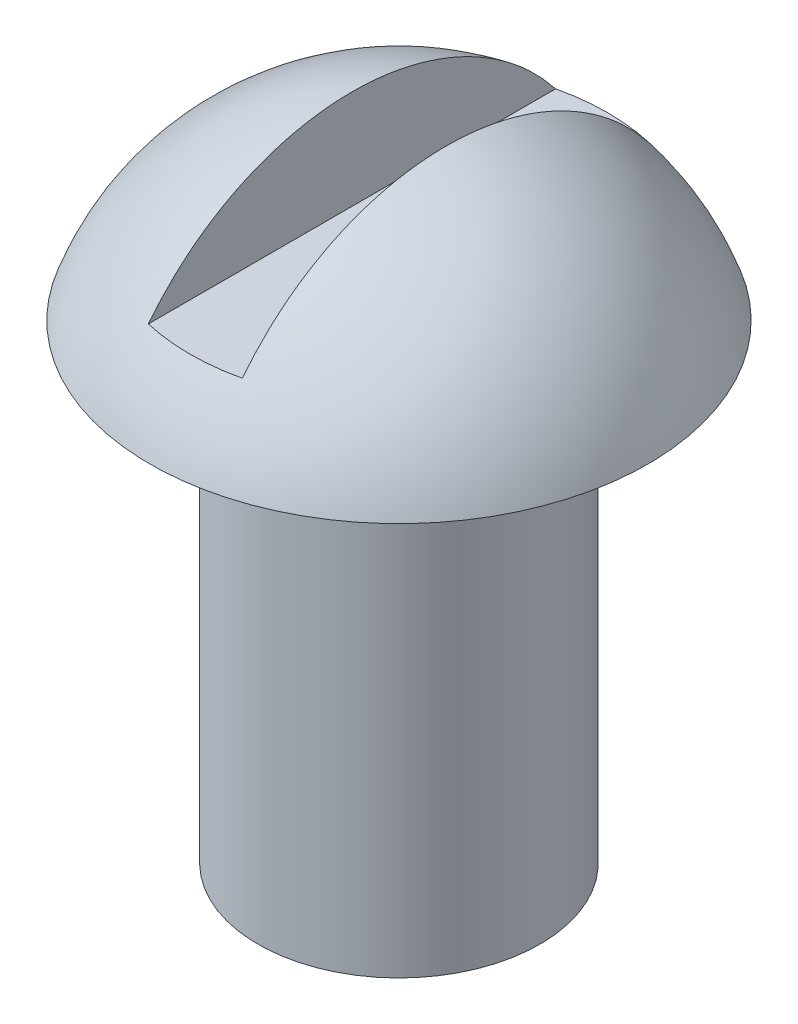
from build123d import *

# Parameters (mm, degrees)
SKETCH_2_W          = 1
SKETCH_2_H          = 5.907580982
CUT_EXTRUDE_1_DEPTH = 1.2
SKETCH_3_R          = 1.5
EXTRUDE_2_DEPTH     = 5


with BuildPart() as part:
    # Эскиз1 → Повернуть1 (revolve)
    with BuildSketch(Plane.XY):
        with BuildLine():
            Line((0, 0), (2.65, 0))
            ThreePointArc((2.65, 0), (1.630375724, 1.375918772), (0, 1.9))
            Line((0, 1.9), (0, 0))
        make_face()
    revolve(axis=Axis((0, 0, 0), (0, 1, 0)))

    # Эскиз2 → Вытянуть1 (cut)
    with BuildSketch(Plane(origin=(0, 2, 0), x_dir=(1, 0, 0), z_dir=(0, 1, 0))):
        Rectangle(SKETCH_2_W, SKETCH_2_H)
    extrude(amount=-CUT_EXTRUDE_1_DEPTH, mode=Mode.SUBTRACT)

    # Эскиз3 → Вытянуть2 (add)
    with BuildSketch(Plane.XZ):
        Circle(SKETCH_3_R)
    extrude(amount=EXTRUDE_2_DEPTH)


solid = part.part
